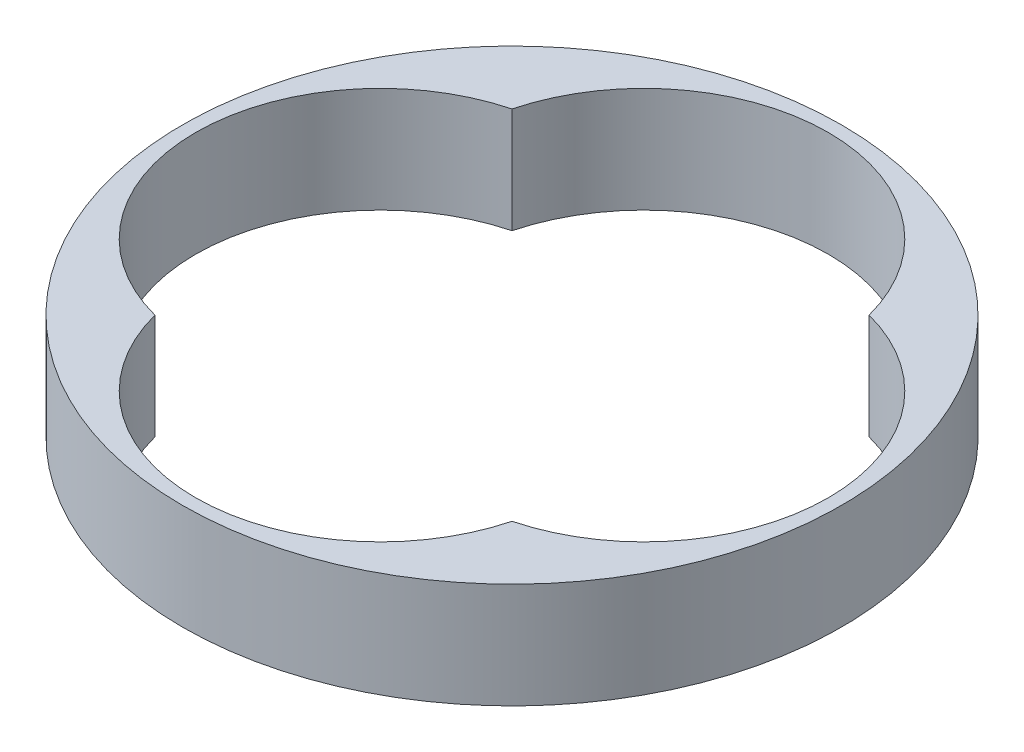
from build123d import *

# Parameters (mm, degrees)
SKETCH1_R           = 62.5
BOSS_EXTRUDE1_DEPTH = 20
SKETCH2_R           = 35
CUT_EXTRUDE1_DEPTH  = 91.622844802


with BuildPart() as part:
    # Sketch1 → Boss-Extrude1 (new body)
    with BuildSketch(Plane(origin=(0, 0, 0), x_dir=(1, 0, 0), z_dir=(0, 1, 0))):
        Circle(SKETCH1_R)
    extrude(amount=BOSS_EXTRUDE1_DEPTH)

    # Sketch2 → Cut-Extrude1 (cut, through all)
    with BuildSketch(Plane(origin=(0, 20, 0), x_dir=(1, 0, 0), z_dir=(0, 1, 0))):
        with Locations((0, 25)):
            Circle(SKETCH2_R)
        with Locations((25, 0)):
            Circle(SKETCH2_R)
        with Locations((0, -25)):
            Circle(SKETCH2_R)
        with Locations((-25, 0)):
            Circle(SKETCH2_R)
    extrude(amount=-CUT_EXTRUDE1_DEPTH, mode=Mode.SUBTRACT)


solid = part.part
